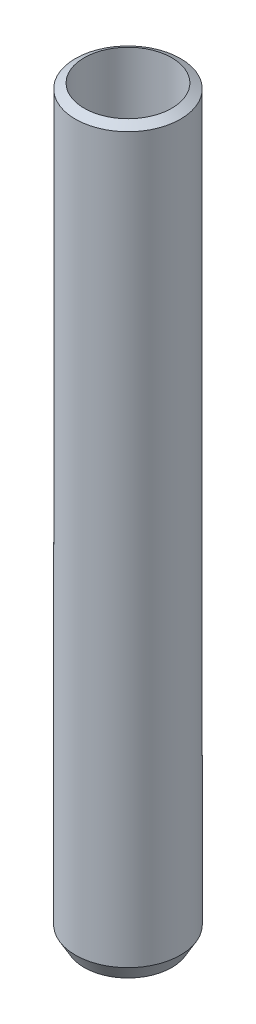
from build123d import *

# Parameters (mm, degrees)
SKETCH1_R           = 30
BOSS_EXTRUDE1_DEPTH = 427.485478
SKETCH2_R           = 25.004464226
CUT_EXTRUDE1_DEPTH  = 430.585653742


with BuildPart() as part:
    # Sketch1 → Boss-Extrude1 (new body)
    with BuildSketch(Plane(origin=(0, 0, 0), x_dir=(1, 0, 0), z_dir=(0, 1, 0))):
        with Locations(Location((0, 0, 0), (0, 0, 270))):
            Circle(SKETCH1_R)
    extrude(amount=BOSS_EXTRUDE1_DEPTH)

    # Sketch2 → Cut-Extrude1 (cut, through all)
    with BuildSketch(Plane(origin=(0, 0, 0), x_dir=(1, 0, 0), z_dir=(0, 1, 0))):
        with Locations(Location((0, 0, 0), (0, 0, 270))):
            Circle(SKETCH2_R)
    extrude(amount=CUT_EXTRUDE1_DEPTH, mode=Mode.SUBTRACT)

    # Chamfer1: read off the stored shape, not the designer's step
    # Chamfer1 outline → Chamfer1 (revolve, cut)
    with BuildSketch(Plane.XY):
        Polygon((30, 422.288826614), (30, 427.485477895), (25.004464226, 427.485477895), (25.004464226, 425.173000538), align=None)
        Polygon((30, 9.000864049), (25.004464226, 0.348342277), (25.004464226, 0), (30, 0), align=None)
    revolve(axis=Axis((0, 0, 0), (0, 1, 0)), mode=Mode.SUBTRACT)


solid = part.part
